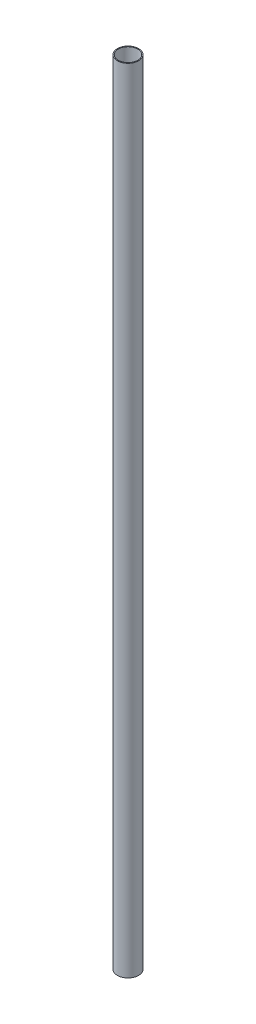
from build123d import *

# Parameters (mm, degrees)
SKETCH_1_R      = 6
SKETCH_1_R_2    = 5.5
EXTRUDE_1_DEPTH = 447.5


with BuildPart() as part:
    # 草图1 → 凸台-拉伸1 (new body)
    with BuildSketch(Plane(origin=(0, 0, 0), x_dir=(1, 0, 0), z_dir=(0, 1, 0))):
        Circle(SKETCH_1_R)
        Circle(SKETCH_1_R_2, mode=Mode.SUBTRACT)
    extrude(amount=EXTRUDE_1_DEPTH)


solid = part.part
